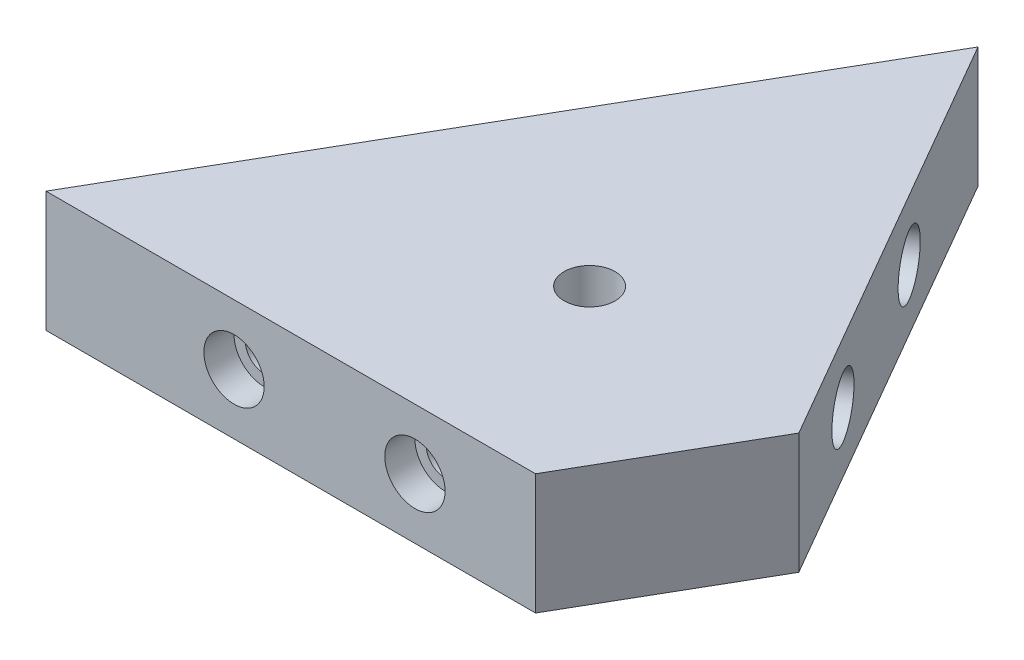
from build123d import *

# Parameters (mm, degrees)
BOSS_EXTRUDE1_DEPTH         = 25.4
SKETCH2_R                   = 6.35
CUT_EXTRUDE1_DEPTH          = 6.35
F_3_8_16_TAPPED_HOLE1_D     = 7.9375
F_3_8_16_TAPPED_HOLE1_DEPTH = 15.875
F_3_8_16_TAPPED_HOLE1_TIP   = 2.384665582
F_1_2_13_TAPPED_HOLE1_D     = 10.71626
F_3_8_16_TAPPED_HOLE2_D     = 7.9375
F_3_8_16_TAPPED_HOLE2_DEPTH = 15.875
F_3_8_16_TAPPED_HOLE2_TIP   = 2.384665582


with BuildPart() as part:
    # Sketch1 → Boss-Extrude1 (new body)
    with BuildSketch(Plane(origin=(0, 0, 0), x_dir=(1, 0, 0), z_dir=(0, 1, 0))):
        Polygon((119.068292428, -241.162389864), (129.21607637, -223.585912492), (51.895065274, -178.944605922), (15.973610966, -241.162389864), align=None)
    boss_extrude1 = extrude(amount=BOSS_EXTRUDE1_DEPTH)

    # Sketch2 → Cut-Extrude1 (cut)
    with BuildSketch(Plane.XY.offset(241.162389864)):
        with Locations((55.568292428, 12.7)):
            Circle(SKETCH2_R)
        with Locations((93.668292428, 12.7)):
            Circle(SKETCH2_R)
    cut_extrude1 = extrude(amount=-CUT_EXTRUDE1_DEPTH, mode=Mode.SUBTRACT)

    # 3/8-16 Tapped Hole1
    with Locations(Plane.XY.offset(234.812389864)):
        with Locations((93.668292428, 12.7), (55.568292428, 12.7)):
            Hole(F_3_8_16_TAPPED_HOLE1_D / 2, depth=F_3_8_16_TAPPED_HOLE1_DEPTH)
            with Locations((0, 0, -(F_3_8_16_TAPPED_HOLE1_DEPTH + F_3_8_16_TAPPED_HOLE1_TIP / 2))):  # 118° drill point
                Cone(0, F_3_8_16_TAPPED_HOLE1_D / 2, F_3_8_16_TAPPED_HOLE1_TIP, mode=Mode.SUBTRACT)

    # Mirror1: Boss-Extrude1, Cut-Extrude1 across plane
    add(boss_extrude1.mirror(Plane(origin=(51.895065274, 25.4, 178.944605922), x_dir=(0.8660254037844389, 0, 0.4999999999999996), z_dir=(-0.49999999999999983, 0, 0.8660254037844388))))
    add(cut_extrude1.mirror(Plane(origin=(51.895065274, 25.4, 178.944605922), x_dir=(0.8660254037844389, 0, 0.4999999999999996), z_dir=(-0.49999999999999983, 0, 0.8660254037844388))), mode=Mode.SUBTRACT)

    # 1/2-13 Tapped Hole1 (through all)
    with Locations(Plane(origin=(0, 25.4, 0), x_dir=(1, 0, 0), z_dir=(0, 1, 0))):
        with Locations((90.555570822, -201.265259207)):
            Hole(F_1_2_13_TAPPED_HOLE1_D / 2)

    # 3/8-16 Tapped Hole2
    with Locations(Plane(origin=(9.818931803, 0, -5.66896292), x_dir=(-0.5000000000000007, 0, -0.8660254037844382), z_dir=(0.8660254037844383, 0, -0.5000000000000008))):
        with Locations((-184.59133439, 12.7), (-222.69133439, 12.7)):
            Hole(F_3_8_16_TAPPED_HOLE2_D / 2, depth=F_3_8_16_TAPPED_HOLE2_DEPTH)
            with Locations((0, 0, -(F_3_8_16_TAPPED_HOLE2_DEPTH + F_3_8_16_TAPPED_HOLE2_TIP / 2))):  # 118° drill point
                Cone(0, F_3_8_16_TAPPED_HOLE2_D / 2, F_3_8_16_TAPPED_HOLE2_TIP, mode=Mode.SUBTRACT)


solid = part.part
